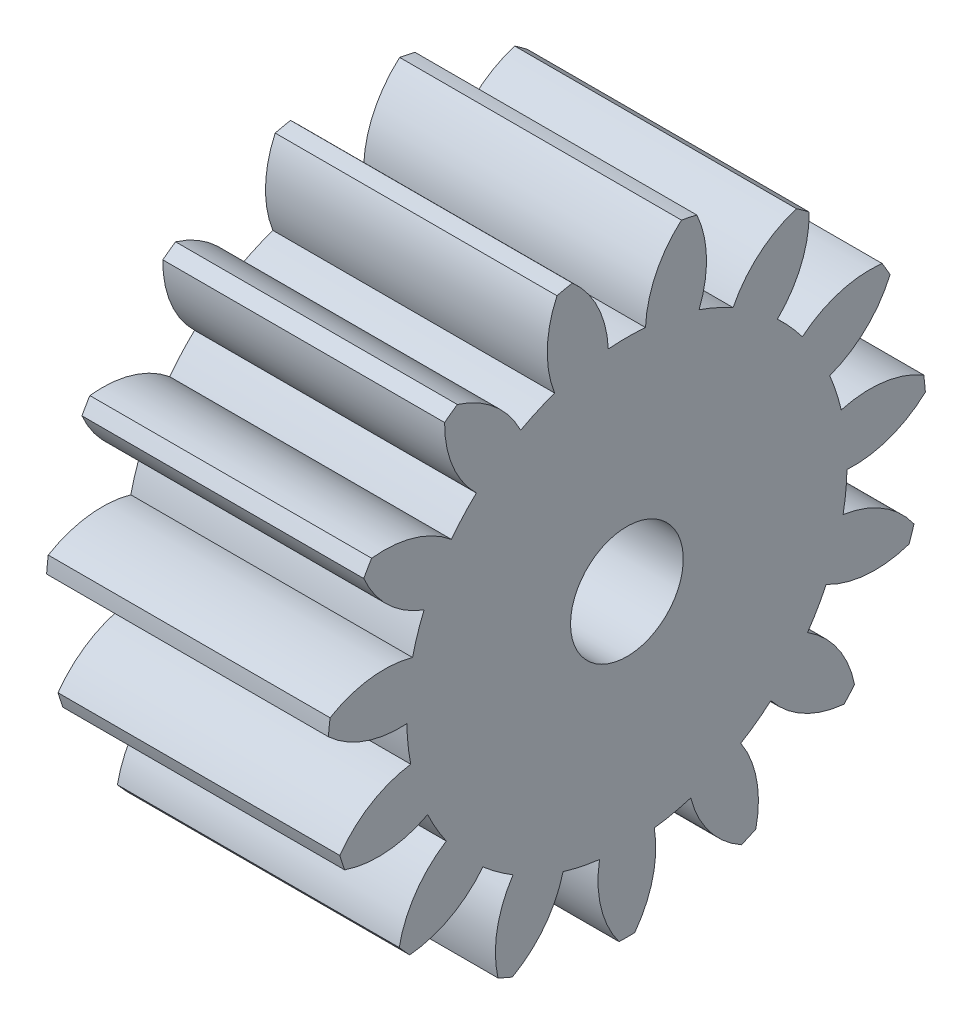
from build123d import *

# Parameters (mm, degrees)
BASPROSKE_W     = 10
BASPROSKE_H     = 10.625
TOOTHCUT_DEPTH  = 19.049411348
TEETHCUTS_COUNT = 15
TEETHCUTS_ANGLE = 336
BORSKE_R        = 2
BORE_DEPTH      = 50.0000508


with BuildPart() as part:
    # BasProSke → Base-Revolve (revolve)
    with BuildSketch(Plane(origin=(0, 0, 0), x_dir=(1, 0, 0), z_dir=(0, 1, 0))):
        with Locations((5, 5.3125)):
            Rectangle(BASPROSKE_W, BASPROSKE_H)
    revolve(axis=Axis((-10, 0, 0), (1, 0, 0)))

    # TooCutSke → ToothCut (cut, through all)
    with BuildSketch(Plane(origin=(0, 0, 0), x_dir=(0, 0, -1), z_dir=(1, 0, 0))):
        with BuildLine():
            ThreePointArc((0.660831632, 7.78349753), (0, 7.8115), (-0.660831632, 7.78349753))
            ThreePointArc((-0.660831632, 7.78349753), (-1.031814994, 9.260718016), (-1.959681305, 10.46855622))
            ThreePointArc((-1.959681305, 10.46855622), (0, 10.6504), (1.959681305, 10.46855622))
            ThreePointArc((1.959681305, 10.46855622), (1.031814994, 9.260718016), (0.660831632, 7.78349753))
        make_face()
    toothcut = extrude(amount=TOOTHCUT_DEPTH, mode=Mode.SUBTRACT)

    # TeethCuts: ToothCut ×15 about axis
    teethcuts_axis = Axis((-10, 0, 0), (1, 0, 0))
    for i in range(1, TEETHCUTS_COUNT):
        add(toothcut.rotate(teethcuts_axis, i * TEETHCUTS_ANGLE / (TEETHCUTS_COUNT - 1)), mode=Mode.SUBTRACT)

    # BorSke → Bore (cut, symmetric)
    with BuildSketch(Plane(origin=(0, 0, 0), x_dir=(0, 0, -1), z_dir=(1, 0, 0))):
        Circle(BORSKE_R)
    extrude(amount=BORE_DEPTH, both=True, mode=Mode.SUBTRACT)


solid = part.part
